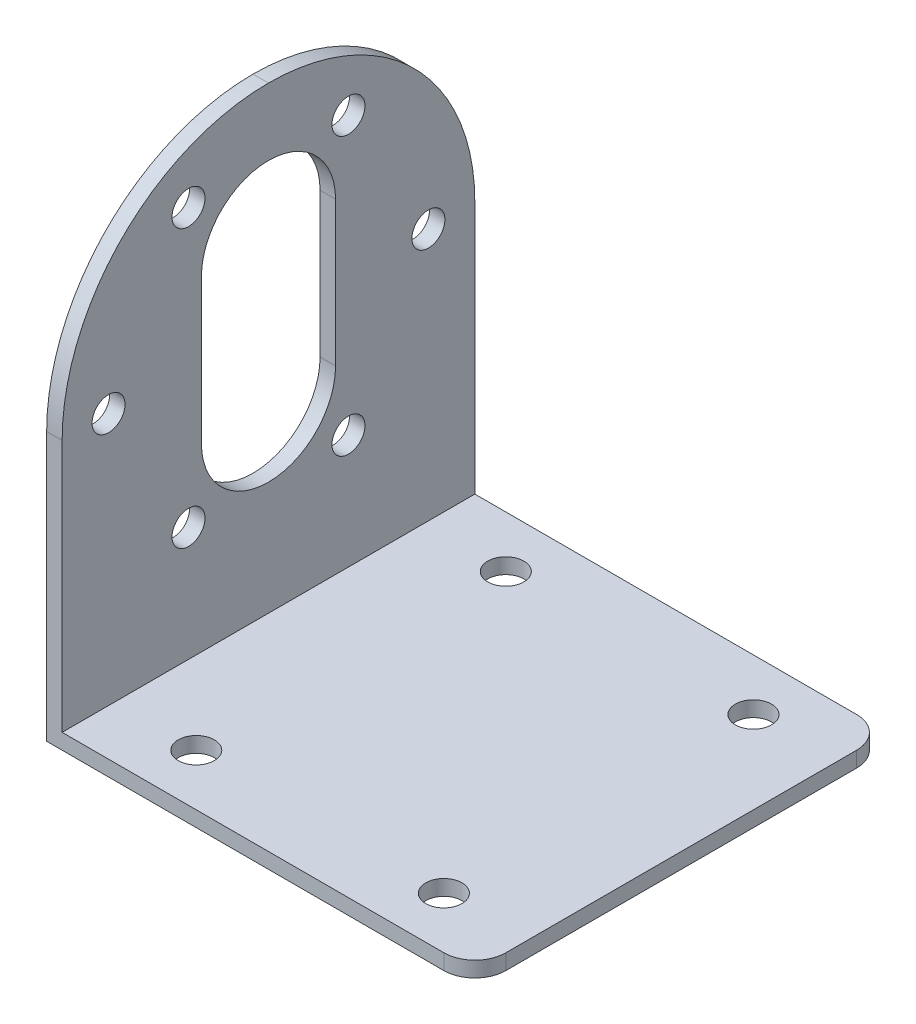
from build123d import *

# Parameters (mm, degrees)
SKETCH_3_W          = 41.5
SKETCH_3_H          = 40
EXTRUDE_1_DEPTH     = 1.5
SKETCH_4_W          = 1.5
SKETCH_4_H          = 40
EXTRUDE_2_DEPTH     = 44.5
SKETCH_5_R          = 1.75
CUT_EXTRUDE_1_DEPTH = 1.5
SKETCH_6_R          = 1.6
CUT_EXTRUDE_2_DEPTH = 1.5
FILLET_3_R          = 20
FILLET_4_R          = 3


with BuildPart() as part:
    # 草图3 → 凸台-拉伸1 (new body)
    with BuildSketch(Plane(origin=(0, 0, 0), x_dir=(1, 0, 0), z_dir=(0, 1, 0))):
        Rectangle(SKETCH_3_W, SKETCH_3_H)
    extrude(amount=EXTRUDE_1_DEPTH)

    # 草图4 → 凸台-拉伸2 (add)
    with BuildSketch(Plane(origin=(0, 1.5, 0), x_dir=(1, 0, 0), z_dir=(0, 1, 0))):
        with Locations((-20, 0)):
            Rectangle(SKETCH_4_W, SKETCH_4_H)
    extrude(amount=EXTRUDE_2_DEPTH)

    # 草图5 → 切除-拉伸1 (cut)
    with BuildSketch(Plane(origin=(0, 1.5, 0), x_dir=(1, 0, 0), z_dir=(0, 1, 0))):
        with Locations(Location((-11.25, 15, 0), (0, 0, 270))):
            Circle(SKETCH_5_R)
        with Locations(Location((12.75, 15, 0), (0, 0, 270))):
            Circle(SKETCH_5_R)
        with Locations(Location((-11.25, -15, 0), (0, 0, 270))):
            Circle(SKETCH_5_R)
        with Locations(Location((12.75, -15, 0), (0, 0, 270))):
            Circle(SKETCH_5_R)
    extrude(amount=-CUT_EXTRUDE_1_DEPTH, mode=Mode.SUBTRACT)

    # 草图6 → 切除-拉伸2 (cut)
    with BuildSketch(Plane(origin=(-19.25, 0, 0), x_dir=(0, 0, -1), z_dir=(1, 0, 0))):
        with Locations((-15.5, 26)):
            Circle(SKETCH_6_R)
        with Locations((-7.75, 39.423393759)):
            Circle(SKETCH_6_R)
        with Locations((7.75, 39.423393759)):
            Circle(SKETCH_6_R)
        with Locations((15.5, 26)):
            Circle(SKETCH_6_R)
        with Locations((7.75, 12.576606241)):
            Circle(SKETCH_6_R)
        with Locations((-7.75, 12.576606241)):
            Circle(SKETCH_6_R)
        with BuildLine():
            Line((-6.5, 33), (-6.5, 19))
            ThreePointArc((-6.5, 19), (0, 12.5), (6.5, 19))
            Line((6.5, 19), (6.5, 33))
            ThreePointArc((6.5, 33), (0, 39.5), (-6.5, 33))
        make_face()
    extrude(amount=-CUT_EXTRUDE_2_DEPTH, mode=Mode.SUBTRACT)

    # 圆角3
    fillet_3_edges = [part.edges().sort_by_distance(p)[0] for p in [
        (-20, 46, -20),
        (-20, 46, 20),
    ]]
    fillet(fillet_3_edges, radius=FILLET_3_R - 0.0001)  # a hair under: the kernel refuses the full size

    # 圆角4
    fillet_4_edges = [part.edges().sort_by_distance(p)[0] for p in [
        (20.75, 0.75, 20),
        (20.75, 0.75, -20),
    ]]
    fillet(fillet_4_edges, radius=FILLET_4_R)


solid = part.part
